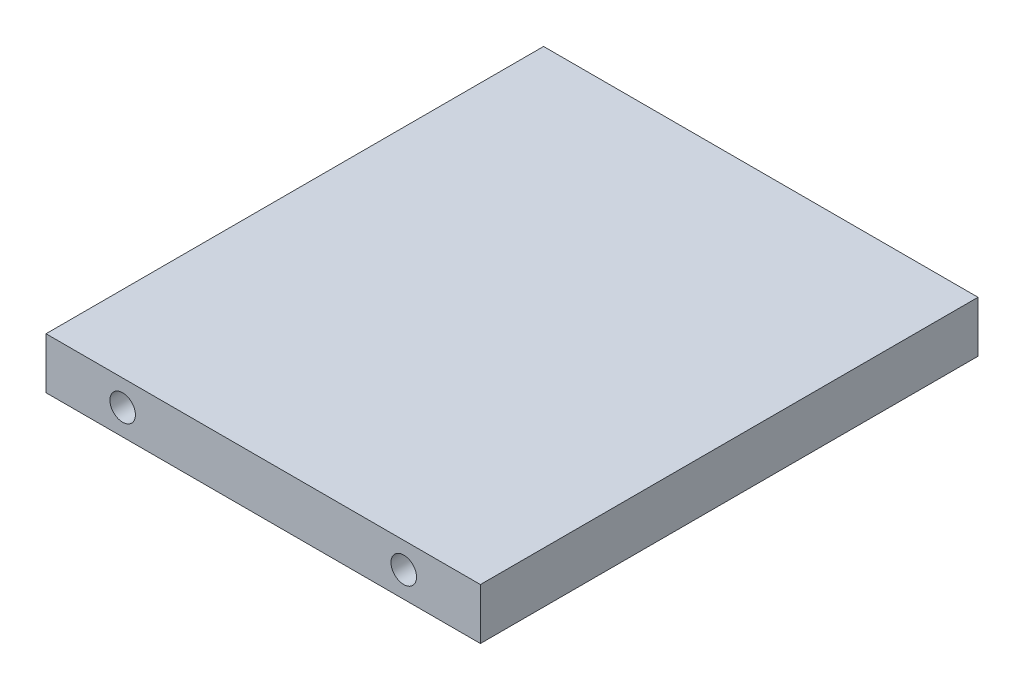
from build123d import *

# Parameters (mm, degrees)
SKETCH1_W           = 107.95
SKETCH1_H           = 12.7
BOSS_EXTRUDE1_DEPTH = 123.65
SKETCH2_R           = 3.175
CUT_EXTRUDE1_DEPTH  = 25.4


with BuildPart() as part:
    # Sketch1 → Boss-Extrude1 (new body)
    with BuildSketch(Plane.XY):
        with Locations((53.975, -6.35)):
            Rectangle(SKETCH1_W, SKETCH1_H)
    extrude(amount=BOSS_EXTRUDE1_DEPTH)

    # Sketch2 → Cut-Extrude1 (cut)
    with BuildSketch(Plane.XY.offset(123.65)):
        with Locations((19.05, -6.35)):
            Circle(SKETCH2_R)
        with Locations((88.9, -6.35)):
            Circle(SKETCH2_R)
    cut_extrude1 = extrude(amount=-CUT_EXTRUDE1_DEPTH, mode=Mode.SUBTRACT)

    # Mirror1: Cut-Extrude1 across plane
    add(cut_extrude1.mirror(Plane.XY.offset(61.825)), mode=Mode.SUBTRACT)


solid = part.part
